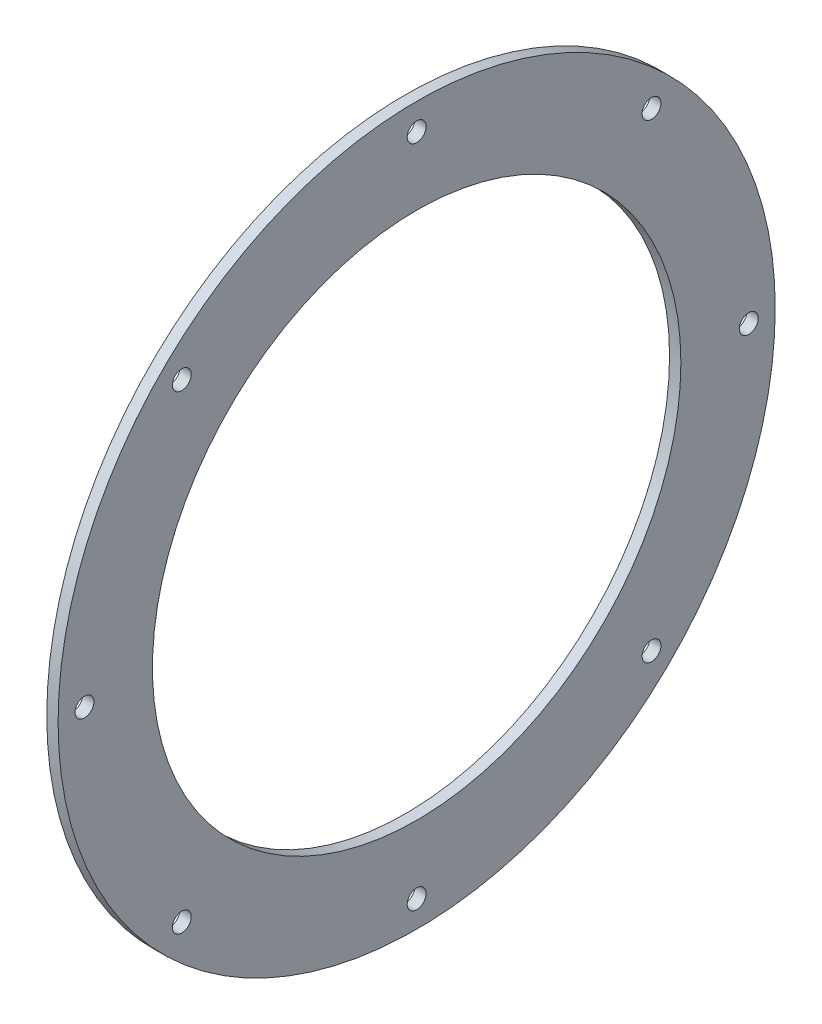
from build123d import *

# Parameters (mm, degrees)
SZKIC1_R                    = 95
SZKIC1_R_2                  = 70
SZKIC1_R_3                  = 2.5
DODANIE_WYCI_GNI_CIE1_DEPTH = 3


with BuildPart() as part:
    # Szkic1 → Dodanie-wyciągnięcie1 (new body)
    with BuildSketch(Plane(origin=(0, 0, 0), x_dir=(0, 0, -1), z_dir=(1, 0, 0))):
        Circle(SZKIC1_R)
        Circle(SZKIC1_R_2, mode=Mode.SUBTRACT)
        with Locations((0, 88)):
            Circle(SZKIC1_R_3, mode=Mode.SUBTRACT)
        with Locations((62.225396744, 62.225396744)):
            Circle(SZKIC1_R_3, mode=Mode.SUBTRACT)
        with Locations((88, 0)):
            Circle(SZKIC1_R_3, mode=Mode.SUBTRACT)
        with Locations((62.225396744, -62.225396744)):
            Circle(SZKIC1_R_3, mode=Mode.SUBTRACT)
        with Locations((0, -88)):
            Circle(SZKIC1_R_3, mode=Mode.SUBTRACT)
        with Locations((-62.225396744, -62.225396744)):
            Circle(SZKIC1_R_3, mode=Mode.SUBTRACT)
        with Locations((-88, 0)):
            Circle(SZKIC1_R_3, mode=Mode.SUBTRACT)
        with Locations((-62.225396744, 62.225396744)):
            Circle(SZKIC1_R_3, mode=Mode.SUBTRACT)
    extrude(amount=DODANIE_WYCI_GNI_CIE1_DEPTH)


solid = part.part
